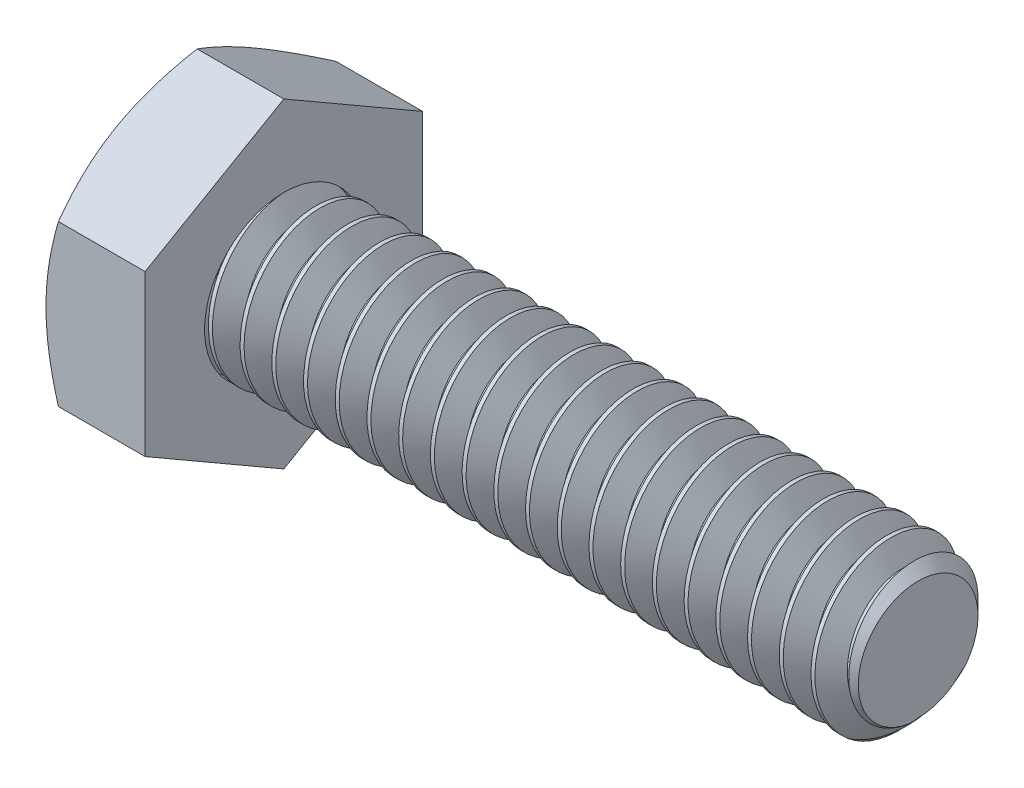
from build123d import *

# Parameters (mm, degrees)
SKETCH5_R           = 3.175
BOSS_EXTRUDE3_DEPTH = 25.4
BOSS_EXTRUDE4_DEPTH = 3.96875
SKETCH8_OUTSIDE_W   = 129.26
SKETCH8_OUTSIDE_H   = 130.98
SKETCH8_OUTSIDE_R   = 5.55625
CUT_EXTRUDE3_DEPTH  = 31.570540439
CUT_EXTRUDE3_DRAFT  = -60
CUT_EXTRUDE4_DEPTH  = 0.254
CIRPATTERN1_COUNT   = 3
CHAMFER1_SIZE       = 0.77724
CUT_SWEEP1_PITCH    = 1.27


with BuildPart() as part:
    # Sketch5 → Boss-Extrude3 (new body)
    with BuildSketch(Plane(origin=(14.684375, 0, 0), x_dir=(0, 0, -1), z_dir=(1, 0, 0))):
        Circle(SKETCH5_R)
    extrude(amount=-BOSS_EXTRUDE3_DEPTH)

    # Sketch6 → Boss-Extrude4 (add)
    with BuildSketch(Plane.ZY.offset(10.715625)):
        Polygon((5.55625, 3.207902433), (0, 6.415804866), (-5.55625, 3.207902433), (-5.55625, -3.207902433), (0, -6.415804866), (5.55625, -3.207902433), align=None)
    extrude(amount=BOSS_EXTRUDE4_DEPTH)


with BuildPart() as cut_extrude3_tool:
    # Sketch8 outside → Cut-Extrude3 (with draft: the straight prism first)
    with BuildSketch(Plane.ZY.offset(14.684375)):
        Rectangle(SKETCH8_OUTSIDE_W, SKETCH8_OUTSIDE_H)
        Circle(SKETCH8_OUTSIDE_R, mode=Mode.SUBTRACT)
    extrude(amount=-CUT_EXTRUDE3_DEPTH)
    # Cut-Extrude3: the draft: its side faces are tilted about the plane it starts from
    cut_extrude3_sides = [cut_extrude3_tool.faces().sort_by_distance(p)[0] for p in [
        (1.100895219, -65.49, 0),
        (1.100895219, 0, 64.63),
        (1.100895219, 65.49, 0),
        (1.100895219, 0, -64.63),
        (1.100895219, 0, -5.55625),
    ]]
    draft(cut_extrude3_sides, Plane.ZY.offset(14.684375), CUT_EXTRUDE3_DRAFT)


with BuildPart() as part_1:
    add(part.part)

    # Cut-Extrude3: cut by cut_extrude3_tool
    add(cut_extrude3_tool.part, mode=Mode.SUBTRACT)

    # Sketch12 → Cut-Extrude4 (cut)
    with BuildSketch(Plane.ZY.offset(14.684375)):
        with BuildLine():
            Line((0.1666875, 4.2783125), (0.1666875, 2.3891875))
            ThreePointArc((0.1666875, 2.3891875), (0, 2.2225), (-0.1666875, 2.3891875))
            Line((-0.1666875, 2.3891875), (-0.1666875, 4.2783125))
            ThreePointArc((-0.1666875, 4.2783125), (0, 4.445), (0.1666875, 4.2783125))
        make_face()
    cut_extrude4 = extrude(amount=-CUT_EXTRUDE4_DEPTH, mode=Mode.SUBTRACT)

    # CirPattern1: Cut-Extrude4 ×3 about axis
    cirpattern1_axis = Axis((0, 0, 0), (1, 0, 0))
    for i in range(1, CIRPATTERN1_COUNT):
        add(cut_extrude4.rotate(cirpattern1_axis, i * 360 / CIRPATTERN1_COUNT), mode=Mode.SUBTRACT)

    # Chamfer1
    chamfer1_edges = [part_1.edges().sort_by_distance(p)[0] for p in [
        (14.684375, 0, 3.175),
    ]]
    chamfer(chamfer1_edges, length=CHAMFER1_SIZE)

    # Cut-Sweep1: the profile of Sketch10 profile screwed along a right-hand helix of 21 turns, 8 arcs to a turn; built about Z, then put on its axis
    cut_sweep1_z = Axis((0, 0, 0), (0, 0, 1))
    cut_sweep1_corners = [(3.1753, 0, 0.000173205), (2.350110803, 0, -0.47625), (2.350110803, 0, -0.635), (3.1753, 0, -1.111423205)]
    with BuildLine(mode=Mode.PRIVATE) as cut_sweep1_profile:
        Line(cut_sweep1_corners[0], cut_sweep1_corners[1])
        Line(cut_sweep1_corners[1], cut_sweep1_corners[2])
        Line(cut_sweep1_corners[2], cut_sweep1_corners[3])
        Line(cut_sweep1_corners[3], cut_sweep1_corners[0])
    cut_sweep1_cap = Face(cut_sweep1_profile.wire())
    cut_sweep1_turn_angles = [0, 22.5, 45, 67.5, 90, 112.5, 135, 157.5, 180, 202.5, 225, 247.5, 270, 292.5, 315, 337.5, 360]
    cut_sweep1_turn_weights = [1, 0.9238795325112867, 1, 0.9238795325112867, 1, 0.9238795325112867, 1, 0.9238795325112867, 1, 0.9238795325112867, 1, 0.9238795325112867, 1, 0.9238795325112867, 1, 0.9238795325112867, 1]
    cut_sweep1_turn_rails = [Edge.make_bspline([Vector(p[0], p[1], 0).rotate(cut_sweep1_z, cut_sweep1_turn_angles[k]) / cut_sweep1_turn_weights[k] + Vector(0, 0, p[2] + CUT_SWEEP1_PITCH * cut_sweep1_turn_angles[k] / 360) for k in range(17)], [0, 0, 0, 1, 1, 2, 2, 3, 3, 4, 4, 5, 5, 6, 6, 7, 7, 8, 8, 8], 2, cut_sweep1_turn_weights) for p in cut_sweep1_corners]
    cut_sweep1_turn_sides = [Face.make_surface_from_curves(cut_sweep1_turn_rails[p[0]], cut_sweep1_turn_rails[p[1]]) for p in [(0, 1), (1, 2), (2, 3), (3, 0)]]
    cut_sweep1 = Plane(origin=(14.684375, 0, 0), x_dir=(0, 1, 0), z_dir=(-1, 0, 0)) * Solid(Shell([*[p.moved(Location((0, 0, CUT_SWEEP1_PITCH * i))) for i in range(21) for p in cut_sweep1_turn_sides], cut_sweep1_cap, cut_sweep1_cap.rotate(cut_sweep1_z, 7560).moved(Location((0, 0, CUT_SWEEP1_PITCH * 7560 / 360)))]))
    add(cut_sweep1, mode=Mode.SUBTRACT)


solid = part_1.part
